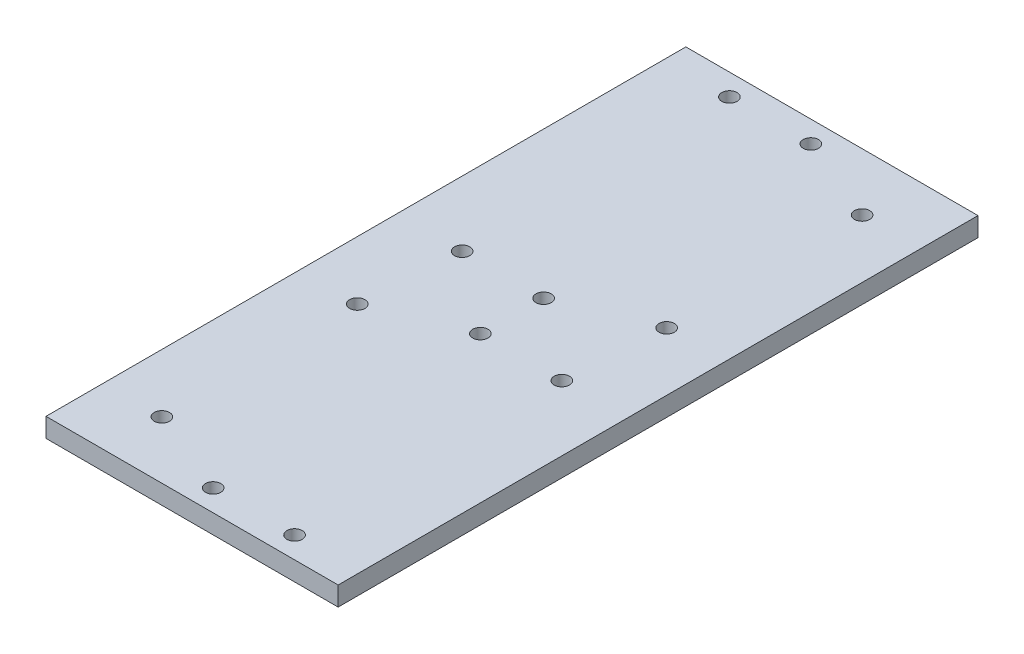
from build123d import *

# Parameters (mm, degrees)
SKETCH_1_W      = 30.5
SKETCH_1_H      = 66.8
SKETCH_1_R      = 0.8
EXTRUDE_1_DEPTH = 2


with BuildPart() as part:
    # 草图1 → 凸台-拉伸1 (new body)
    with BuildSketch(Plane(origin=(0, 0, 0), x_dir=(1, 0, 0), z_dir=(0, 1, 0))):
        with Locations((15.25, -33.4)):
            Rectangle(SKETCH_1_W, SKETCH_1_H)
        with Locations((6.1, -60.8)):
            Circle(SKETCH_1_R, mode=Mode.SUBTRACT)
        with Locations((15.2, -64.55)):
            Circle(SKETCH_1_R, mode=Mode.SUBTRACT)
        with Locations((6.1, -40.4)):
            Circle(SKETCH_1_R, mode=Mode.SUBTRACT)
        with Locations((15.2, -36.65)):
            Circle(SKETCH_1_R, mode=Mode.SUBTRACT)
        with Locations((23.7, -64.55)):
            Circle(SKETCH_1_R, mode=Mode.SUBTRACT)
        with Locations((23.7, -36.65)):
            Circle(SKETCH_1_R, mode=Mode.SUBTRACT)
        with Locations((6.8, -30.15)):
            Circle(SKETCH_1_R, mode=Mode.SUBTRACT)
        with Locations((6.8, -2.25)):
            Circle(SKETCH_1_R, mode=Mode.SUBTRACT)
        with Locations((15.3, -30.15)):
            Circle(SKETCH_1_R, mode=Mode.SUBTRACT)
        with Locations((24.4, -26.4)):
            Circle(SKETCH_1_R, mode=Mode.SUBTRACT)
        with Locations((15.3, -2.25)):
            Circle(SKETCH_1_R, mode=Mode.SUBTRACT)
        with Locations((24.4, -6)):
            Circle(SKETCH_1_R, mode=Mode.SUBTRACT)
    extrude(amount=EXTRUDE_1_DEPTH)


solid = part.part
